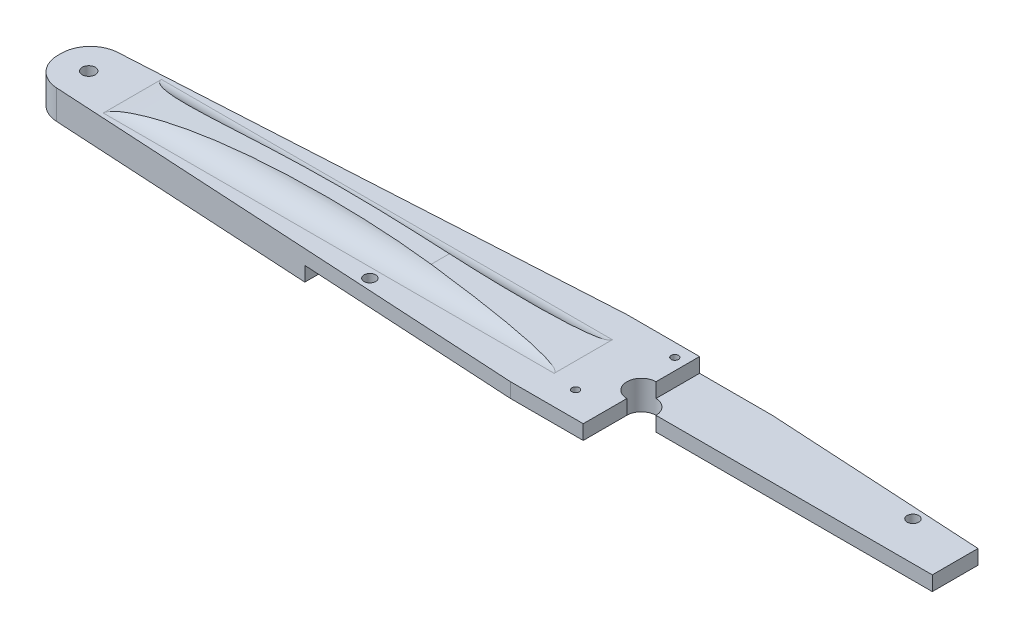
from build123d import *

# Parameters (mm, degrees)
BOSS_EXTRUDE1_DEPTH  = 20
SKETCH3_R            = 1.25
SKETCH3_R_2          = 5
SKETCH3_R_3          = 2.25
CUT_EXTRUDE1_DEPTH   = 40
CUT_EXTRUDE2_DEPTH   = 40
MIRROR2_COPY_1_DEPTH = 40
BOSS_EXTRUDE3_DEPTH  = 2.5
SKETCH6_W            = 107.318523781
SKETCH6_H            = 36.59372062
CUT_EXTRUDE3_DEPTH   = 25
SKETCH7_W            = 103.85031415
SKETCH7_H            = 15.718097745
CUT_EXTRUDE4_DEPTH   = 50
SKETCH8_W            = 102.493521885
SKETCH8_H            = 23.554949116
CUT_EXTRUDE5_DEPTH   = 50
SKETCH9_W            = 100
SKETCH9_H            = 5
CUT_EXTRUDE6_DEPTH   = 50
FILLET1_R            = 400
FILLET2_R            = 10
FILLET3_START        = -2.629939755
FILLET3_DEPTH        = 5.259872573
FILLET3_START_2      = -10.0000001
FILLET3_2_DEPTH      = 20.0000001
FILLET3_START_3      = -176
FILLET3_3_DEPTH      = 156
SKETCH10_R           = 2
CUT_EXTRUDE7_DEPTH   = 10


with BuildPart() as part:
    # Sketch2 → Boss-Extrude1 (new, symmetric)
    with BuildSketch(Plane.XY):
        Polygon((0, 0), (200, 0), (200, 10), (-200, 10), (-200, 0), align=None)
    extrude(amount=BOSS_EXTRUDE1_DEPTH, both=True)

    # Sketch3 → Cut-Extrude1 (cut)
    with BuildSketch(Plane(origin=(0, 10, 0), x_dir=(1, 0, 0), z_dir=(0, 1, 0))):
        with Locations(Location((-4, 15.491933385, 0), (0, 0, 180))):
            Circle(SKETCH3_R)
        with Locations(Location((15.416407865, -4.281865077, 0), (0, 0, 180))):
            Circle(SKETCH3_R)
        with Locations(Location((-11.416407865, -11.210068308, 0), (0, 0, 180))):
            Circle(SKETCH3_R)
        with Locations(Location((0, 0, 0), (0, 0, 180))):
            Circle(SKETCH3_R_2)
        with Locations(Location((-190, 0, 0), (0, 0, 180))):
            Circle(SKETCH3_R_3)
        with Locations(Location((190, 0, 0), (0, 0, 270))):
            Circle(SKETCH3_R_3)
    extrude(amount=-CUT_EXTRUDE1_DEPTH, mode=Mode.SUBTRACT)

    # Sketch4 → Cut-Extrude2 (cut)
    with BuildSketch(Plane(origin=(0, 10, 0), x_dir=(1, 0, 0), z_dir=(0, 1, 0))):
        Polygon((-205.682411406, 30.266574236), (-25, 30.266574236), (-25, 20), (-200, 10), (-205.682411406, 10), align=None)
    cut_extrude2 = extrude(amount=-CUT_EXTRUDE2_DEPTH, mode=Mode.SUBTRACT)

    # Mirror1: Cut-Extrude2 across plane
    add(cut_extrude2.mirror(Plane(origin=(0, 0, 0), x_dir=(0, 0, 1), z_dir=(1, 0, 0))), mode=Mode.SUBTRACT)

    # Mirror2: Cut-Extrude2 across plane
    add(cut_extrude2.mirror(Plane.XY), mode=Mode.SUBTRACT)

    # Mirror2 copy 1 sketch → Mirror2 copy 1 (cut)
    with BuildSketch(Plane(origin=(0, 10, 0), x_dir=(-1, 0, 0), z_dir=(0, 1, 0))):
        Polygon((-205.682411406, 30.266574236), (-25, 30.266574236), (-25, 20), (-200, 10), (-205.682411406, 10), align=None)
    extrude(amount=-MIRROR2_COPY_1_DEPTH, mode=Mode.SUBTRACT)

    # Sketch5 → Boss-Extrude3 (add, symmetric)
    with BuildSketch(Plane.XY):
        Polygon((-175, 10), (-20, 10), (-130, 20), align=None)
    boss_extrude3 = extrude(amount=BOSS_EXTRUDE3_DEPTH, both=True)

    # Mirror3: Boss-Extrude3 across plane
    add(boss_extrude3.mirror(Plane(origin=(0, 0, 0), x_dir=(0, 0, 1), z_dir=(1, 0, 0))))

    # Sketch6 → Cut-Extrude3 (cut, symmetric)
    with BuildSketch(Plane.XY):
        with Locations((153.659261891, 18.29686031)):
            Rectangle(SKETCH6_W, SKETCH6_H)
    extrude(amount=CUT_EXTRUDE3_DEPTH, both=True, mode=Mode.SUBTRACT)

    # Sketch7 → Cut-Extrude4 (cut)
    with BuildSketch(Plane.XY):
        with Locations((51.925157075, 12.859048873)):
            Rectangle(SKETCH7_W, SKETCH7_H)
    extrude(amount=-CUT_EXTRUDE4_DEPTH, mode=Mode.SUBTRACT)

    # Sketch8 → Cut-Extrude5 (cut)
    with BuildSketch(Plane.XY):
        with Locations((51.246760943, 11.777474558)):
            Rectangle(SKETCH8_W, SKETCH8_H)
    extrude(amount=CUT_EXTRUDE5_DEPTH, mode=Mode.SUBTRACT)

    # Sketch9 → Cut-Extrude6 (cut)
    with BuildSketch(Plane.XY):
        with Locations((-50, 2.5)):
            Rectangle(SKETCH9_W, SKETCH9_H)
    extrude(amount=CUT_EXTRUDE6_DEPTH, mode=Mode.SUBTRACT)

    # Fillet1
    # the kernel refuses this fillet: 400 mm, written as the material it takes off along each edge
    with BuildSketch(Plane(origin=(-130, 20, 155.27904863), x_dir=(-0.9761870601839527, -0.21693045781865625, 0), z_dir=(0, 0, -1))) as fillet1_piece_1:
        with BuildLine():
            CenterArc((63.556611275, -399.618802355), FILLET1_R, 92.501596354, 15.221640262)
            Line((-58.21114592, -18.603562098), (-60.646501064, -10.983257293))
            Line((-60.646501064, -10.983257293), (-2.435355144, 7.620304805))
            Line((-2.435355144, 7.620304805), (0, 8))
            ThreePointArc((0, 8), (23.048861143, 8), (45.748544507, 7.992376047))
            Line((45.748544507, 7.992376047), (46.097722286, 0))
        make_face()
    extrude(amount=310.558097261, mode=Mode.SUBTRACT)

    # Fillet2
    fillet2_edges = [part.edges().sort_by_distance(p)[0] for p in [
        (-200, 5, -10),
        (-200, 5, 10),
    ]]
    fillet(fillet2_edges, radius=FILLET2_R)

    # Fillet3: read off the stored shape, not the designer's step
    # Fillet3 outline → Fillet3 (add)
    with BuildSketch(Plane.XY.offset(FILLET3_START)):
        with BuildLine():
            Line((-20, 10), (-69.139353351, 14.467213941))
            ThreePointArc((-69.139353351, 14.467213941), (-122.218339331, 15.75425111), (-175.000186885, 9.999966956))
            Line((-175.000186885, 9.999966956), (-20, 10))
        make_face()
    extrude(amount=FILLET3_DEPTH)

    # Fillet3 2 outline → Fillet3 2 (add)
    with BuildSketch(Plane.XY.offset(FILLET3_START_2)):
        with BuildLine():
            Line((-20, 10), (-69.139353351, 14.467213941))
            ThreePointArc((-69.139353351, 14.467213941), (-122.218339331, 15.75425111), (-175.000186885, 9.999966956))
            Line((-175.000186885, 9.999966956), (-20, 10))
        make_face()
    extrude(amount=FILLET3_2_DEPTH)

    # Fillet3 3 outline → Fillet3 3 (cut)
    with BuildSketch(Plane.YZ.offset(FILLET3_START_3)):
        with BuildLine():
            ThreePointArc((10, 10), (11.726129638, 5.213307923), (16.109978945, 2.629936129))
            Line((16.109978945, 2.629936129), (18, 2.273471232))
            Line((18, 2.273471232), (18, 10))
            Line((18, 10), (10, 10))
        make_face()
        with BuildLine():
            Line((18, -10.0000001), (18, -2.273470992))
            Line((18, -2.273470992), (16.109978046, -2.629936298))
            ThreePointArc((16.109978046, -2.629936298), (11.726129346, -5.213308275), (10, -10))
            Line((10, -10), (18, -10.0000001))
        make_face()
    extrude(amount=FILLET3_3_DEPTH, mode=Mode.SUBTRACT)

    # Sketch10 → Cut-Extrude7 (cut)
    with BuildSketch(Plane.XZ):
        with Locations(Location((-80, 13.351433229, 0), (0, 0, 270))):
            Circle(SKETCH10_R)
        with Locations(Location((80, -13.351433229, 0), (0, 0, 270))):
            Circle(SKETCH10_R)
    extrude(amount=-CUT_EXTRUDE7_DEPTH, mode=Mode.SUBTRACT)


solid = part.part
